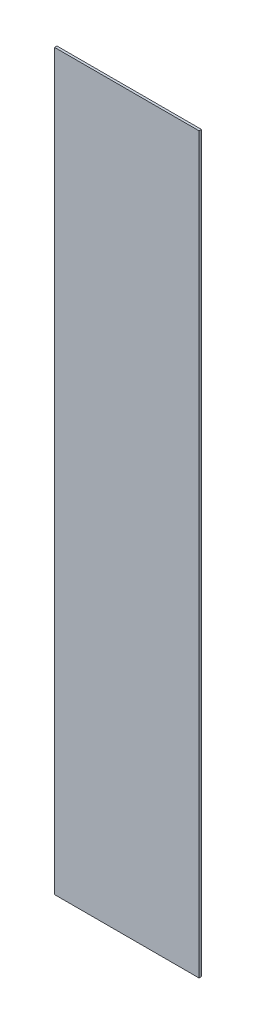
from build123d import *

# Parameters (mm, degrees)
SKETCH1_W           = 120
SKETCH1_H           = 609.6
BOSS_EXTRUDE1_DEPTH = 2


with BuildPart() as part:
    # Sketch1 → Boss-Extrude1 (new body)
    with BuildSketch(Plane.XY):
        Rectangle(SKETCH1_W, SKETCH1_H)
    extrude(amount=BOSS_EXTRUDE1_DEPTH)


solid = part.part
